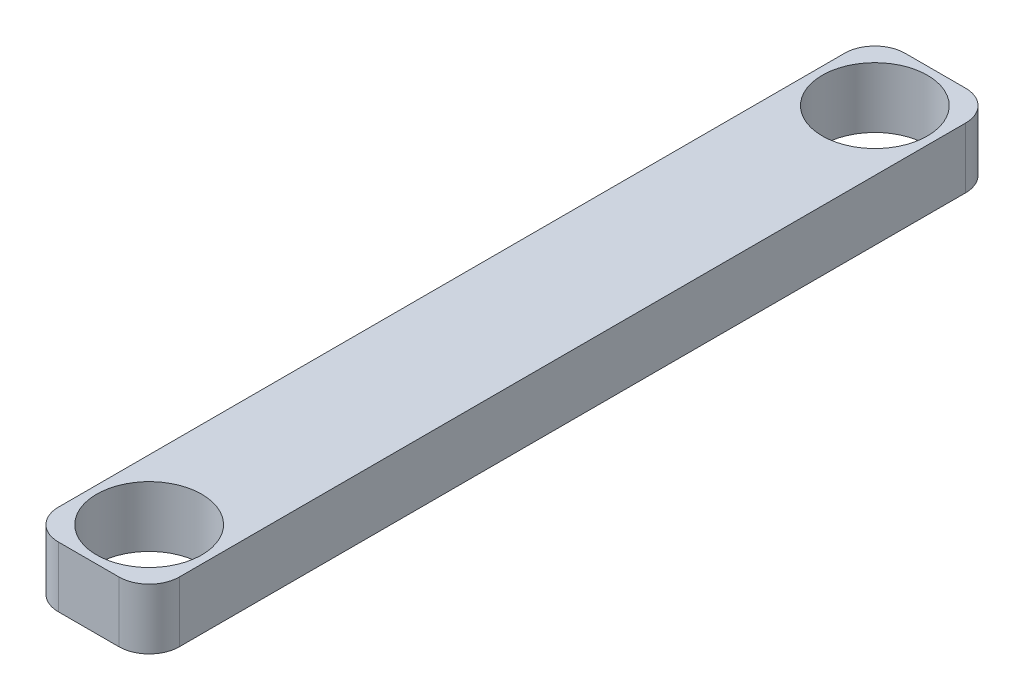
from build123d import *

# Parameters (mm, degrees)
SKETCH1_W           = 25.4
SKETCH1_H           = 177.8
BOSS_EXTRUDE1_DEPTH = 6.35
FILLET1_R           = 6.35
SKETCH2_R           = 11.05
CUT_EXTRUDE1_DEPTH  = 91.696141042


with BuildPart() as part:
    # Sketch1 → Boss-Extrude1 (new, symmetric)
    with BuildSketch(Plane(origin=(0, 0, 0), x_dir=(1, 0, 0), z_dir=(0, 1, 0))):
        Rectangle(SKETCH1_W, SKETCH1_H)
    extrude(amount=BOSS_EXTRUDE1_DEPTH, both=True)

    # Fillet1
    fillet1_edges = [part.edges().sort_by_distance(p)[0] for p in [
        (12.7, 0, -88.9),
        (-12.7, 0, -88.9),
        (12.7, 0, 88.9),
        (-12.7, 0, 88.9),
    ]]
    fillet(fillet1_edges, radius=FILLET1_R)

    # Sketch2 → Cut-Extrude1 (cut, through all)
    with BuildSketch(Plane(origin=(0, 6.35, 0), x_dir=(1, 0, 0), z_dir=(0, 1, 0))):
        with Locations((0, 76.2)):
            Circle(SKETCH2_R)
    cut_extrude1 = extrude(amount=-CUT_EXTRUDE1_DEPTH, mode=Mode.SUBTRACT)

    # Mirror2: Cut-Extrude1 across plane
    add(cut_extrude1.mirror(Plane.XY), mode=Mode.SUBTRACT)


solid = part.part
